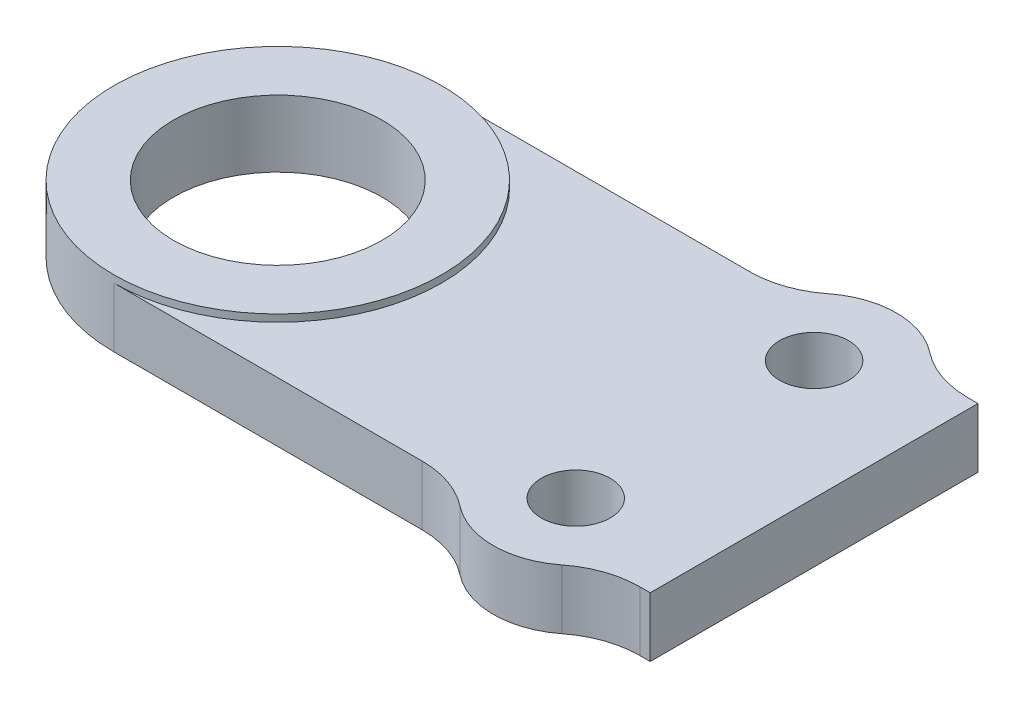
from build123d import *

# Parameters (mm, degrees)
SKETCH1_R           = 11.1125
BOSS_EXTRUDE1_DEPTH = 6.35
SKETCH2_R           = 3.675
CUT_EXTRUDE1_DEPTH  = 69.098630246
FILLET3_R           = 10
SKETCH4_R           = 17.4625
BOSS_EXTRUDE2_DEPTH = 0.762
CUT_EXTRUDE2_START  = -0.762
SKETCH7_R           = 11.1125
CUT_EXTRUDE2_DEPTH  = 0.762


with BuildPart() as part:
    # Sketch1 → Boss-Extrude1 (new body)
    with BuildSketch(Plane(origin=(0, 0, 0), x_dir=(1, 0, 0), z_dir=(0, 1, 0))):
        with BuildLine():
            Line((-44.298962551, 23.958717105), (-7.224092757, 23.958717105))
            ThreePointArc((-7.224092757, 23.958717105), (0.151037449, 27.975394277), (7.526167656, 23.958717105))
            Line((7.526167656, 23.958717105), (12.851037449, 23.958717105))
            Line((12.851037449, 23.958717105), (12.851037449, -10.966282895))
            Line((12.851037449, -10.966282895), (7.526167656, -10.966282895))
            ThreePointArc((7.526167656, -10.966282895), (0.151037449, -14.982960066), (-7.224092757, -10.966282895))
            Line((-7.224092757, -10.966282895), (-44.298962551, -10.966282895))
            ThreePointArc((-44.298962551, -10.966282895), (-61.761462551, 6.496217105), (-44.298962551, 23.958717105))
        make_face()
        with Locations((-44.298962551, 6.496217105)):
            Circle(SKETCH1_R, mode=Mode.SUBTRACT)
    extrude(amount=BOSS_EXTRUDE1_DEPTH)

    # Sketch2 → Cut-Extrude1 (cut, through all)
    with BuildSketch(Plane(origin=(0, 6.35, 0), x_dir=(1, 0, 0), z_dir=(0, 1, 0))):
        with Locations((0.151037449, 19.196217105)):
            Circle(SKETCH2_R)
        with Locations((0.151037449, -6.203782895)):
            Circle(SKETCH2_R)
    extrude(amount=-CUT_EXTRUDE1_DEPTH, mode=Mode.SUBTRACT)

    # Fillet3
    fillet3_edges = [part.edges().sort_by_distance(p)[0] for p in [
        (7.526167656, 3.175, -23.958717105),
        (-7.224092757, 3.175, -23.958717105),
        (-7.224092757, 3.175, 10.966282895),
        (7.526167656, 3.175, 10.966282895),
    ]]
    fillet(fillet3_edges, radius=FILLET3_R)

    # Sketch4 → Boss-Extrude2 (add)
    with BuildSketch(Plane(origin=(0, 6.35, 0), x_dir=(1, 0, 0), z_dir=(0, 1, 0))):
        with Locations((-44.298962551, 6.496217105)):
            Circle(SKETCH4_R)
    extrude(amount=BOSS_EXTRUDE2_DEPTH)

    # Sketch7 → Cut-Extrude2 (cut)
    with BuildSketch(Plane(origin=(0, 7.112, 0), x_dir=(1, 0, 0), z_dir=(0, 1, 0)).offset(CUT_EXTRUDE2_START)):
        with Locations((-44.298962551, 6.496217105)):
            Circle(SKETCH7_R)
    extrude(amount=CUT_EXTRUDE2_DEPTH, mode=Mode.SUBTRACT)


solid = part.part
